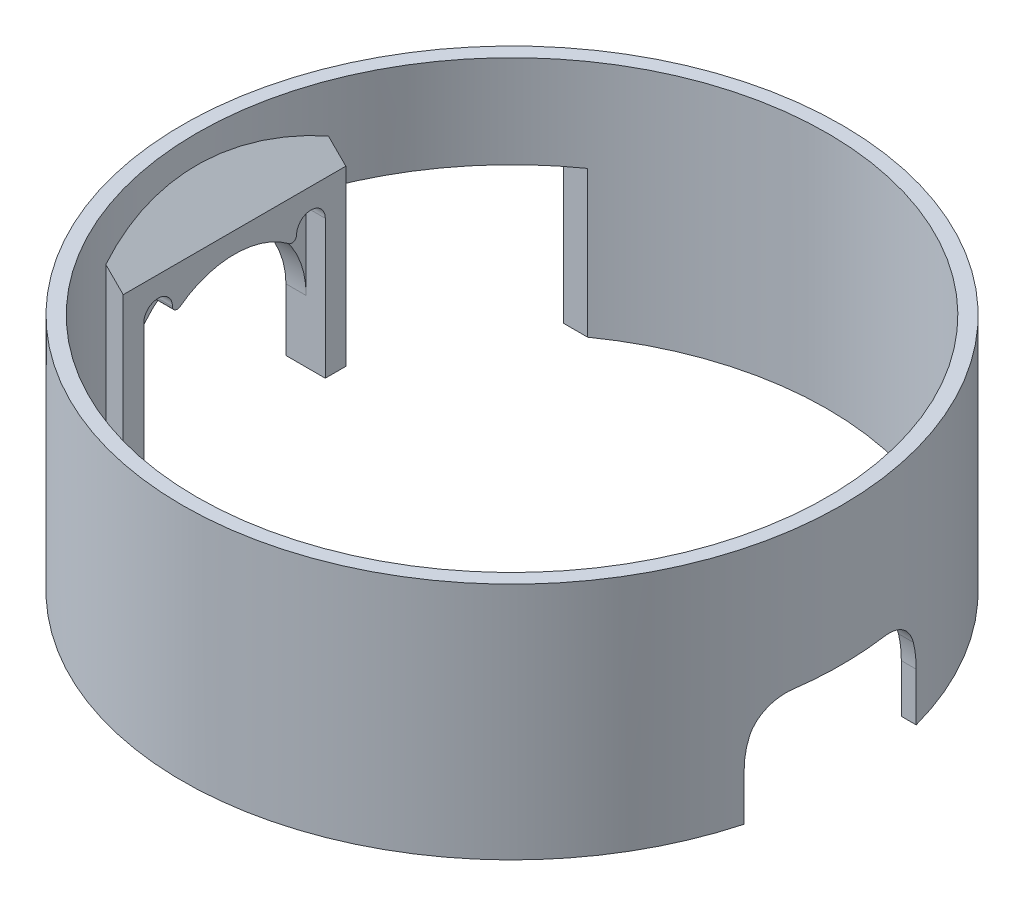
from build123d import *

# Parameters (mm, degrees)
SKETCH1_R           = 69
SKETCH1_R_2         = 66
BOSS_EXTRUDE1_DEPTH = 50
SKETCH4_W           = 30.6
SKETCH4_H           = 30.6
CUT_EXTRUDE2_DEPTH  = 110.644881321
CUT_EXTRUDE6_DEPTH  = 110.644881321
BOSS_EXTRUDE2_REACH = 169.745
BOSS_EXTRUDE2_START = -58.1
SKETCH8_W           = 46.6
SKETCH8_H           = 35
BOSS_EXTRUDE4_DEPTH = 30
SKETCH9_OUTSIDE_W   = 206.079
SKETCH9_OUTSIDE_H   = 183.51
SKETCH9_OUTSIDE_R   = 69
CUT_EXTRUDE7_DEPTH  = 126.083349102
CUT_EXTRUDE8_DEPTH  = 110.644881321
CUT_EXTRUDE9_DEPTH  = 110.644881321
CUT_EXTRUDE11_DEPTH = 4
FILLET3_R           = 1
CUT_EXTRUDE12_DEPTH = 110.644881493


with BuildPart() as part:
    # Sketch1 → Boss-Extrude1 (new body)
    with BuildSketch(Plane(origin=(0, 0, 0), x_dir=(1, 0, 0), z_dir=(0, 1, 0))):
        Circle(SKETCH1_R)
        Circle(SKETCH1_R_2, mode=Mode.SUBTRACT)
    extrude(amount=BOSS_EXTRUDE1_DEPTH)

    # Sketch4 → Cut-Extrude2 (cut, through all)
    with BuildSketch(Plane(origin=(0, 0, 0), x_dir=(0, 0, -1), z_dir=(1, 0, 0))):
        with Locations((38.6, 15.3)):
            Rectangle(SKETCH4_W, SKETCH4_H)
    extrude(amount=-CUT_EXTRUDE2_DEPTH, mode=Mode.SUBTRACT)

    # Sketch5 → Cut-Extrude6 (cut, through all)
    with BuildSketch(Plane(origin=(0, 0, 0), x_dir=(0, 0, -1), z_dir=(1, 0, 0))):
        with BuildLine():
            Line((19, 13), (19, -6))
            Line((19, -6), (-19, -6))
            Line((-19, -6), (-19, 13))
            ThreePointArc((-19, 13), (0, 32), (19, 13))
        make_face()
    extrude(amount=-CUT_EXTRUDE6_DEPTH, mode=Mode.SUBTRACT)

    # Sketch6 → Boss-Extrude2 (add, up to next)
    with BuildSketch(Plane(origin=(0, 0, 0), x_dir=(0, 0, -1), z_dir=(1, 0, 0)).offset(BOSS_EXTRUDE2_START), mode=Mode.PRIVATE) as boss_extrude2_sk1:
        with BuildLine():
            Line((19, 13), (19, 0))
            Line((19, 0), (23.3, 0))
            Line((23.3, 0), (23.3, 13))
            ThreePointArc((23.3, 13), (0, 36.3), (-23.3, 13))
            Line((-23.3, 13), (-23.3, 0))
            Line((-23.3, 0), (-19, 0))
            Line((-19, 0), (-19, 13))
            ThreePointArc((-19, 13), (0, 32), (19, 13))
        make_face()
    boss_extrude2_tool1 = extrude(boss_extrude2_sk1.sketch, amount=-BOSS_EXTRUDE2_REACH, mode=Mode.PRIVATE) - part.part
    add(boss_extrude2_tool1.solids().sort_by_distance((-58.1, 6.5, 22.709301))[0])

    # Sketch8 → Boss-Extrude4 (add)
    with BuildSketch(Plane(origin=(-10.9, -10.9, 0), x_dir=(0, 0, -1), z_dir=(-0.7071067811865512, -0.7071067811865438, 0))):
        with Locations((0, -66.582903987)):
            Rectangle(SKETCH8_W, SKETCH8_H)
    extrude(amount=BOSS_EXTRUDE4_DEPTH)

    # Sketch9 outside → Cut-Extrude7 (cut, through all)
    with BuildSketch(Plane.XZ):
        with Locations((-11.2845, 0)):
            Rectangle(SKETCH9_OUTSIDE_W, SKETCH9_OUTSIDE_H)
        Circle(SKETCH9_OUTSIDE_R, mode=Mode.SUBTRACT)
    extrude(amount=-CUT_EXTRUDE7_DEPTH, mode=Mode.SUBTRACT)

    # Sketch9<3> → Cut-Extrude8 (cut, through all)
    with BuildSketch(Plane.XZ):
        with BuildLine():
            Line((-58.1, -19), (-58.1, -23.3))
            Line((-58.1, -23.3), (-61.750384614, -23.3))
            ThreePointArc((-61.750384614, -23.3), (-52.211852364, -40.372298334), (-38.089237325, -53.9))
            ThreePointArc((-38.089237325, -53.9), (63.102674486, 19.340436209), (-61.750384614, 23.3))
            Line((-61.750384614, 23.3), (-58.1, 23.3))
            Line((-58.1, 23.3), (-58.1, 19))
            Line((-58.1, 19), (-58.1, -19))
        make_face()
    extrude(amount=-CUT_EXTRUDE8_DEPTH, mode=Mode.SUBTRACT)

    # Sketch5<2> → Cut-Extrude9 (cut, through all)
    with BuildSketch(Plane(origin=(0, 0, 0), x_dir=(0, 0, -1), z_dir=(1, 0, 0))):
        with BuildLine():
            Line((19, 13), (19, -6))
            Line((19, -6), (-19, -6))
            Line((-19, -6), (-19, 13))
            ThreePointArc((-19, 13), (0, 32), (19, 13))
        make_face()
    extrude(amount=-CUT_EXTRUDE9_DEPTH, mode=Mode.SUBTRACT)

    # Sketch11 → Cut-Extrude11 (cut)
    with BuildSketch(Plane(origin=(-58.1, 0, 0), x_dir=(0, 0, -1), z_dir=(1, 0, 0))):
        with BuildLine():
            Line((-19.000000298, 29.000000238), (-19, 11.000000238))
            Line((-19, 11.000000238), (-13.000000298, 11.000000238))
            Line((-13.000000298, 11.000000238), (-13.000000298, 29.000000238))
            ThreePointArc((-13.000000298, 29.000000238), (-16.000000298, 32.000000238), (-19.000000298, 29.000000238))
        make_face()
        with BuildLine():
            Line((12.999999702, 29.000000238), (12.999999702, 11.000000238))
            Line((12.999999702, 11.000000238), (19, 11.000000238))
            Line((19, 11.000000238), (18.999999702, 29.000000238))
            ThreePointArc((18.999999702, 29.000000238), (15.999999702, 32.000000238), (12.999999702, 29.000000238))
        make_face()
    extrude(amount=-CUT_EXTRUDE11_DEPTH, mode=Mode.SUBTRACT)

    # Fillet3
    fillet3_edges = [part.edges().sort_by_distance(p)[0] for p in [
        (-60.1, 26.85640674, -12.999999702),
        (-60.1, 26.856406181, 13.000000298),
    ]]
    fillet(fillet3_edges, radius=FILLET3_R)

    # Sketch12 → Cut-Extrude12 (cut, through all)
    with BuildSketch(Plane(origin=(0, 0, 0), x_dir=(0, 0, -1), z_dir=(1, 0, 0))):
        with BuildLine():
            Line((-18, -0.9), (18, -0.9))
            Line((18, -0.9), (18.000000017, 10.1))
            ThreePointArc((18.000000017, 10.1), (17.791519176, 12.831639219), (17.170905634, 15.500001246))
            ThreePointArc((17.170905634, 15.500001246), (14.272255846, 19.549807449), (9.539392014, 21.100001244))
            Line((9.539392014, 21.100001244), (-9.539392014, 21.100001244))
            ThreePointArc((-9.539392014, 21.100001244), (-14.272255841, 19.549807443), (-17.170905626, 15.500001244))
            ThreePointArc((-17.170905626, 15.500001244), (-17.791519159, 12.831639216), (-18, 10.1))
            Line((-18, 10.1), (-18, -0.9))
        make_face()
    extrude(amount=CUT_EXTRUDE12_DEPTH, mode=Mode.SUBTRACT)


solid = part.part
